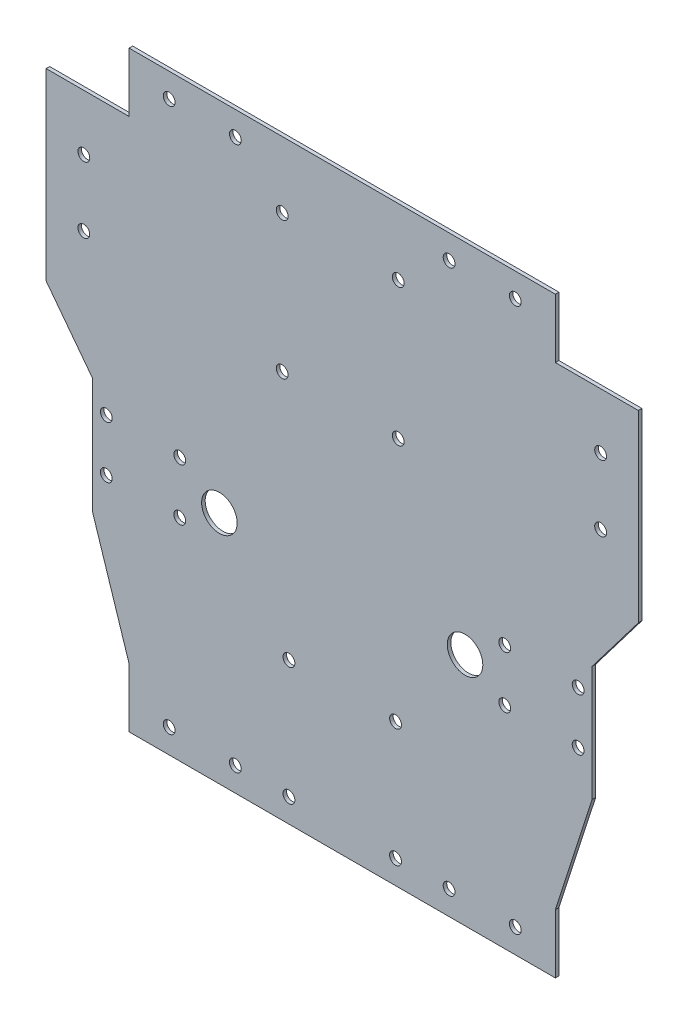
from build123d import *

# Parameters (mm, degrees)
SKETCH1_W               = 300
SKETCH1_H               = 250
BOSS_EXTRUDE1_DEPTH     = 1.5
CUT_EXTRUDE1_DEPTH      = 391.515364615
CUT_EXTRUDE1_DEPTH_BACK = 391.515364615
SKETCH3_R               = 7.5
SKETCH6_W               = 35
SKETCH6_H               = 25
SKETCH6_W_2             = 12.5
SKETCH6_H_2             = 77.656290199
CUT_EXTRUDE3_DEPTH      = 381.996719146
SKETCH5_R               = 2.5
CUT_EXTRUDE2_DEPTH      = 372.654745698


with BuildPart() as part:
    # Sketch1 → Boss-Extrude1 (new body)
    with BuildSketch(Plane.XY):
        with Locations((150, 125)):
            Rectangle(SKETCH1_W, SKETCH1_H)
    extrude(amount=-BOSS_EXTRUDE1_DEPTH)

    # Sketch3 → Cut-Extrude1 (cut, two sides: drawn at the far end of the back side and taken through both)
    with BuildSketch(Plane.XY.offset(-CUT_EXTRUDE1_DEPTH_BACK)):
        Polygon((0, 0), (25, 0), (25, 47.343709801), (44.5, 73.000027506), (44.5, 121.687392097), (25, 147.343709801), (12.5, 147.343709801), (12.5, 225), (25, 225), (25, 250), (0, 250), align=None)
        Polygon((275, 0), (300, 0), (300, 250), (275, 250), (275, 225), (287.5, 225), (287.5, 147.343709801), (275, 147.343709801), (255.5, 121.687392097), (255.5, 73.000027506), (275, 47.343709801), align=None)
        with Locations((201.85, 99.125843129)):
            Circle(SKETCH3_R)
        with Locations((98.15, 99.125843129)):
            Circle(SKETCH3_R)
    extrude(amount=CUT_EXTRUDE1_DEPTH + CUT_EXTRUDE1_DEPTH_BACK, mode=Mode.SUBTRACT)

    # Sketch6 → Cut-Extrude3 (cut, through all)
    with BuildSketch(Plane.XY):
        Polygon((25, 0), (60, 0), (60, 25), (44.5, 73.000027506), (25, 47.343709801), align=None)
        Polygon((240, 0), (275, 0), (275, 47.343709801), (255.5, 73.000027506), (240, 25), align=None)
        with Locations((257.5, 237.5)):
            Rectangle(SKETCH6_W, SKETCH6_H)
        with Locations((281.25, 186.171854901)):
            Rectangle(SKETCH6_W_2, SKETCH6_H_2)
        with Locations((18.75, 186.171854901)):
            Rectangle(SKETCH6_W_2, SKETCH6_H_2)
        with Locations((42.5, 237.5)):
            Rectangle(SKETCH6_W, SKETCH6_H)
    extrude(amount=-CUT_EXTRUDE3_DEPTH, mode=Mode.SUBTRACT)

    # Sketch5 → Cut-Extrude2 (cut, symmetric)
    with BuildSketch(Plane.XY):
        with Locations((76.94, 10.16)):
            Circle(SKETCH5_R)
    cut_extrude2 = extrude(amount=CUT_EXTRUDE2_DEPTH, both=True, mode=Mode.SUBTRACT)

    # Sketch-Pattern1: Cut-Extrude2 at 27 more places
    with Locations((-36.023145, 191.31, 0), (-36.023145, 163.37, 0), (0, 229.68, 0), (27.94, 229.68, 0), (118.18, 229.68, 0), (146.12, 229.68, 0), (182.143145, 191.31, 0), (182.143145, 163.37, 0), (118.18, 0, 0), (146.12, 0, 0), (27.94, 0, 0), (50.56, -0.16, 0), (95.56, -0.16, 0), (50.56, 49.84, 0), (95.56, 49.84, 0), (47.705277, 153.86209, 0), (96.705277, 153.86209, 0), (47.705277, 211.86209, 0), (96.705277, 211.86209, 0), (141.66, 100.84, 0), (172.66, 100.84, 0), (172.66, 78.84, 0), (141.66, 78.84, 0), (4.46, 78.846294, 0), (-26.54, 78.846294, 0), (4.46, 100.846294, 0), (-26.54, 100.846294, 0)):
        add(cut_extrude2, mode=Mode.SUBTRACT)


solid = part.part
